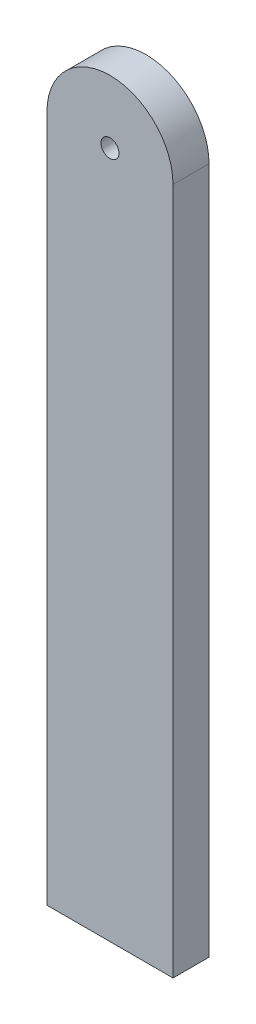
from build123d import *

# Parameters (mm, degrees)
SKETCH1_R           = 4.7625
BOSS_EXTRUDE1_DEPTH = 9.525


with BuildPart() as part:
    # Sketch1 → Boss-Extrude1 (new, symmetric)
    with BuildSketch(Plane.XY):
        with BuildLine():
            Line((33.3375, -198.4375), (-33.3375, -198.4375))
            Line((-33.3375, -198.4375), (-33.3375, 165.1))
            ThreePointArc((-33.3375, 165.1), (0, 198.4375), (33.3375, 165.1))
            Line((33.3375, 165.1), (33.3375, -198.4375))
        make_face()
        with Locations((0, 165.1)):
            Circle(SKETCH1_R, mode=Mode.SUBTRACT)
    extrude(amount=BOSS_EXTRUDE1_DEPTH, both=True)


solid = part.part
